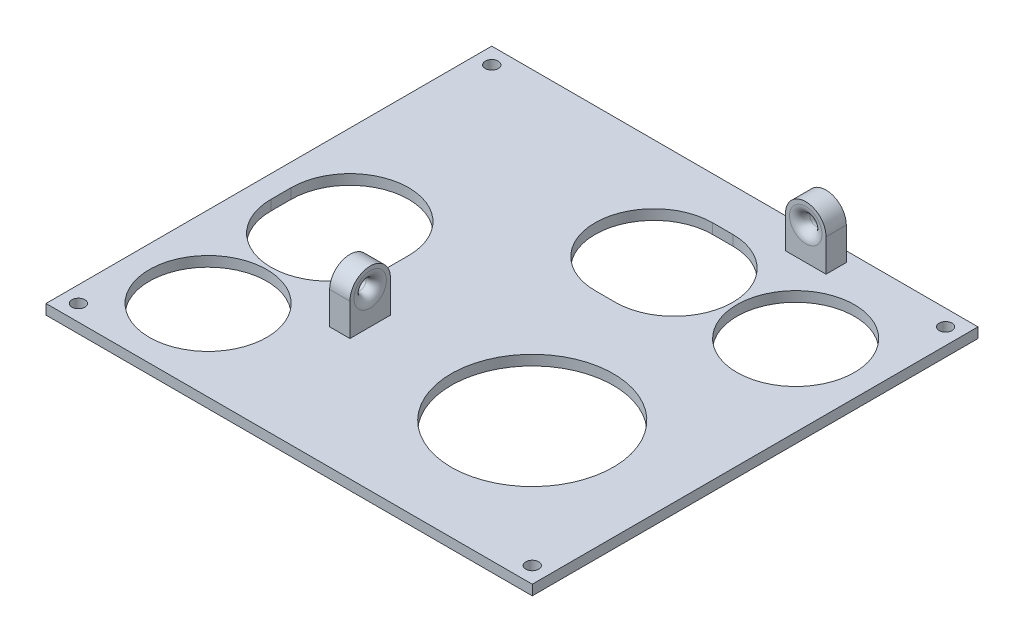
from build123d import *

# Parameters (mm, degrees)
SKETCH1_W           = 120
SKETCH1_H           = 110
BOSS_EXTRUDE1_DEPTH = 2.5
SKETCH2_R           = 14.5
CUT_EXTRUDE1_DEPTH  = 4
SKETCH3_R           = 20
CUT_EXTRUDE2_DEPTH  = 10
SKETCH5_R           = 1.6
CUT_EXTRUDE5_DEPTH  = 10
CUT_EXTRUDE6_DEPTH  = 10
SKETCH8_W           = 5
SKETCH8_H           = 10
SKETCH8_W_2         = 10
SKETCH8_H_2         = 5
BOSS_EXTRUDE2_DEPTH = 14
SKETCH9_R           = 1.5
CUT_EXTRUDE7_DEPTH  = 120.910383203
SKETCH10_R          = 1.5
CUT_EXTRUDE8_DEPTH  = 5
FILLET1_R           = 2.5


with BuildPart() as part:
    # Sketch1 → Boss-Extrude1 (new body)
    with BuildSketch(Plane(origin=(0, 0, 0), x_dir=(1, 0, 0), z_dir=(0, 1, 0))):
        Rectangle(SKETCH1_W, SKETCH1_H)
    extrude(amount=BOSS_EXTRUDE1_DEPTH)

    # Sketch2 → Cut-Extrude1 (cut)
    with BuildSketch(Plane(origin=(0, 2.5, 0), x_dir=(1, 0, 0), z_dir=(0, 1, 0))):
        with Locations(Location((40, 30, 0), (0, 0, 270))):
            Circle(SKETCH2_R)
        with Locations(Location((10, 30, 0), (0, 0, 270))):
            Circle(SKETCH2_R)
        with Locations(Location((-40, -5, 0), (0, 0, 270))):
            Circle(SKETCH2_R)
        with Locations(Location((-40, -35, 0), (0, 0, 270))):
            Circle(SKETCH2_R)
    extrude(amount=-CUT_EXTRUDE1_DEPTH, mode=Mode.SUBTRACT)

    # Sketch3 → Cut-Extrude2 (cut)
    with BuildSketch(Plane(origin=(0, 2.5, 0), x_dir=(1, 0, 0), z_dir=(0, 1, 0))):
        with Locations(Location((25, -20, 0), (0, 0, 270))):
            Circle(SKETCH3_R)
    extrude(amount=-CUT_EXTRUDE2_DEPTH, mode=Mode.SUBTRACT)

    # Sketch5 → Cut-Extrude5 (cut)
    with BuildSketch(Plane(origin=(0, 2.5, 0), x_dir=(1, 0, 0), z_dir=(0, 1, 0))):
        with Locations(Location((-56, 51, 0), (0, 0, 270))):
            Circle(SKETCH5_R)
        with Locations(Location((56, 51, 0), (0, 0, 270))):
            Circle(SKETCH5_R)
        with Locations(Location((56, -51, 0), (0, 0, 270))):
            Circle(SKETCH5_R)
        with Locations(Location((-56, -51, 0), (0, 0, 270))):
            Circle(SKETCH5_R)
    extrude(amount=-CUT_EXTRUDE5_DEPTH, mode=Mode.SUBTRACT)

    # Sketch7 → Cut-Extrude6 (cut)
    with BuildSketch(Plane(origin=(0, 2.5, 0), x_dir=(1, 0, 0), z_dir=(0, 1, 0))):
        with BuildLine():
            Line((-54.5, -5), (-54.5, 0))
            ThreePointArc((-54.5, 0), (-40, 14.5), (-25.5, 0))
            Line((-25.5, 0), (-25.5, -5))
            ThreePointArc((-25.5, -5), (-40, -19.5), (-54.5, -5))
        make_face()
        with BuildLine():
            Line((10, 15.5), (5, 15.5))
            ThreePointArc((5, 15.5), (-9.5, 30), (5, 44.5))
            Line((5, 44.5), (10, 44.5))
            ThreePointArc((10, 44.5), (24.5, 30), (10, 15.5))
        make_face()
    extrude(amount=-CUT_EXTRUDE6_DEPTH, mode=Mode.SUBTRACT)

    # Sketch8 → Boss-Extrude2 (add)
    with BuildSketch(Plane(origin=(0, 2.5, 0), x_dir=(1, 0, 0), z_dir=(0, 1, 0))):
        with Locations((-17.5, -20)):
            Rectangle(SKETCH8_W, SKETCH8_H)
        with Locations((25, 50)):
            Rectangle(SKETCH8_W_2, SKETCH8_H_2)
    extrude(amount=BOSS_EXTRUDE2_DEPTH)

    # Sketch9 → Cut-Extrude7 (cut, through all)
    with BuildSketch(Plane.XY.offset(-47.5)):
        with Locations((25, 10.5)):
            Circle(SKETCH9_R)
        with BuildLine():
            Line((20, 10.5), (20, 22.099022081))
            Line((20, 22.099022081), (30, 22.099022081))
            Line((30, 22.099022081), (30, 10.5))
            ThreePointArc((30, 10.5), (25, 15.5), (20, 10.5))
        make_face()
    extrude(amount=-CUT_EXTRUDE7_DEPTH, mode=Mode.SUBTRACT)

    # Sketch10 → Cut-Extrude8 (cut)
    with BuildSketch(Plane(origin=(-15, 0, 0), x_dir=(0, 0, -1), z_dir=(1, 0, 0))):
        with Locations((-20, 10.5)):
            Circle(SKETCH10_R)
        with BuildLine():
            Line((-25, 10.5), (-25, 23.531098802))
            Line((-25, 23.531098802), (-15, 23.531098802))
            Line((-15, 23.531098802), (-15, 10.5))
            ThreePointArc((-15, 10.5), (-20, 15.5), (-25, 10.5))
        make_face()
    extrude(amount=-CUT_EXTRUDE8_DEPTH, mode=Mode.SUBTRACT)

    # Fillet1
    fillet1_edges = [part.edges().sort_by_distance(p)[0] for p in [
        (23.5, 10.5, -52.5),
        (23.5, 10.5, -47.5),
        (-20, 10.5, 21.5),
        (-15, 10.5, 21.5),
    ]]
    fillet(fillet1_edges, radius=FILLET1_R - 0.0001)  # a hair under: the kernel refuses the full size


solid = part.part
